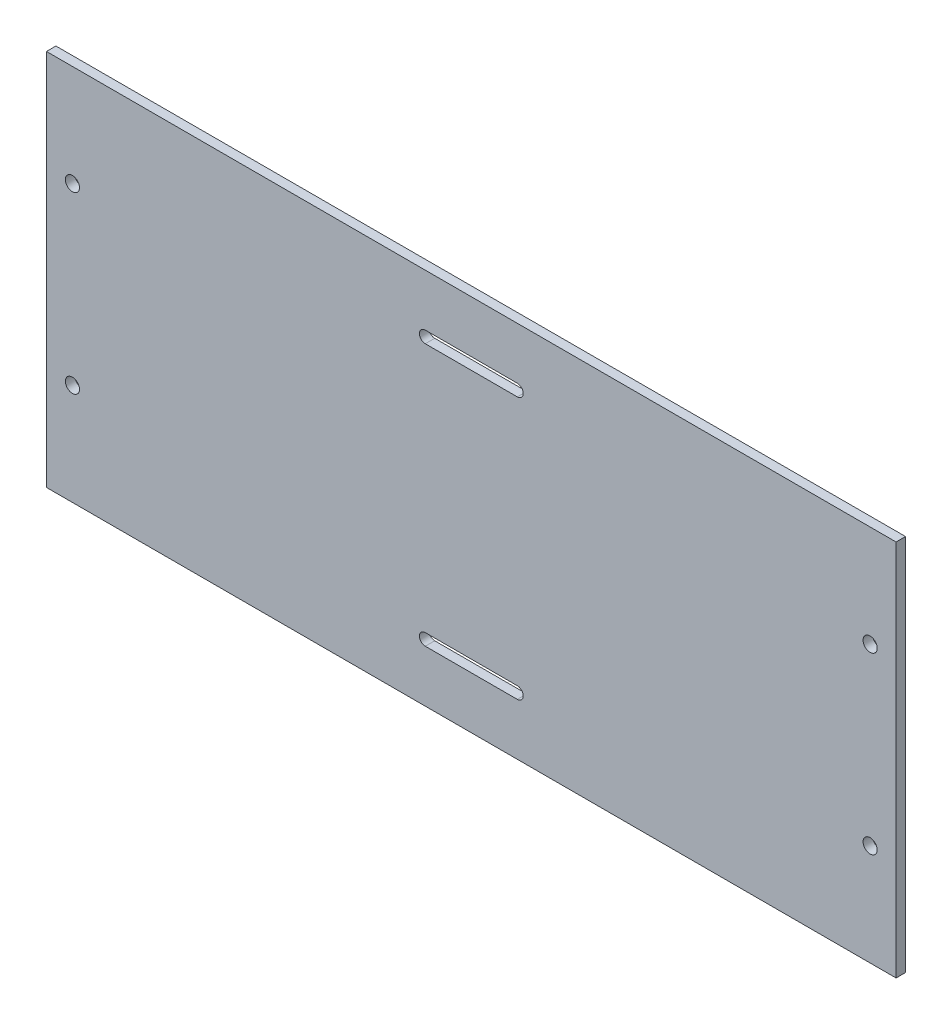
from build123d import *

# Parameters (mm, degrees)
ESBO_O1_W                = 180
ESBO_O1_H                = 80
RESSALTO_EXTRUS_O1_DEPTH = 2
ESBO_O2_R                = 1.5
CORTE_EXTRUS_O1_DEPTH    = 2
ESBO_O3_W                = 22
ESBO_O3_H                = 2.5
CORTE_EXTRUS_O2_DEPTH    = 2
FILETE4_R                = 1.25
FILETE5_R                = 1.25
FILETE6_R                = 1.25
FILETE7_R                = 1.25


with BuildPart() as part:
    # Esboço1 → Ressalto-extrusão1 (new body)
    with BuildSketch(Plane.XY):
        with Locations((90, -40)):
            Rectangle(ESBO_O1_W, ESBO_O1_H)
    extrude(amount=RESSALTO_EXTRUS_O1_DEPTH)

    # Esboço2 → Corte-extrusão1 (cut)
    with BuildSketch(Plane.XY.offset(2)):
        with Locations((5.5, -58.5)):
            Circle(ESBO_O2_R)
        with Locations((5.5, -21.5)):
            Circle(ESBO_O2_R)
        with Locations((174.5, -21.5)):
            Circle(ESBO_O2_R)
        with Locations((174.5, -58.5)):
            Circle(ESBO_O2_R)
    extrude(amount=-CORTE_EXTRUS_O1_DEPTH, mode=Mode.SUBTRACT)

    # Esboço3 → Corte-extrusão2 (cut)
    with BuildSketch(Plane.XY):
        with Locations((90, -12.25)):
            Rectangle(ESBO_O3_W, ESBO_O3_H)
        with Locations((90, -67.75)):
            Rectangle(ESBO_O3_W, ESBO_O3_H)
    extrude(amount=CORTE_EXTRUS_O2_DEPTH, mode=Mode.SUBTRACT)

    # Filete4
    filete4_edges = [part.edges().sort_by_distance(p)[0] for p in [
        (79, -11, 1),
        (79, -13.5, 1),
    ]]
    fillet(filete4_edges, radius=FILETE4_R - 0.0001)  # a hair under: the kernel refuses the full size

    # Filete5
    filete5_edges = [part.edges().sort_by_distance(p)[0] for p in [
        (101, -13.5, 1),
        (101, -11, 1),
    ]]
    fillet(filete5_edges, radius=FILETE5_R - 0.0001)  # a hair under: the kernel refuses the full size

    # Filete6
    filete6_edges = [part.edges().sort_by_distance(p)[0] for p in [
        (79, -66.5, 1),
        (79, -69, 1),
    ]]
    fillet(filete6_edges, radius=FILETE6_R - 0.0001)  # a hair under: the kernel refuses the full size

    # Filete7
    filete7_edges = [part.edges().sort_by_distance(p)[0] for p in [
        (101, -69, 1),
        (101, -66.5, 1),
    ]]
    fillet(filete7_edges, radius=FILETE7_R - 0.0001)  # a hair under: the kernel refuses the full size


solid = part.part
